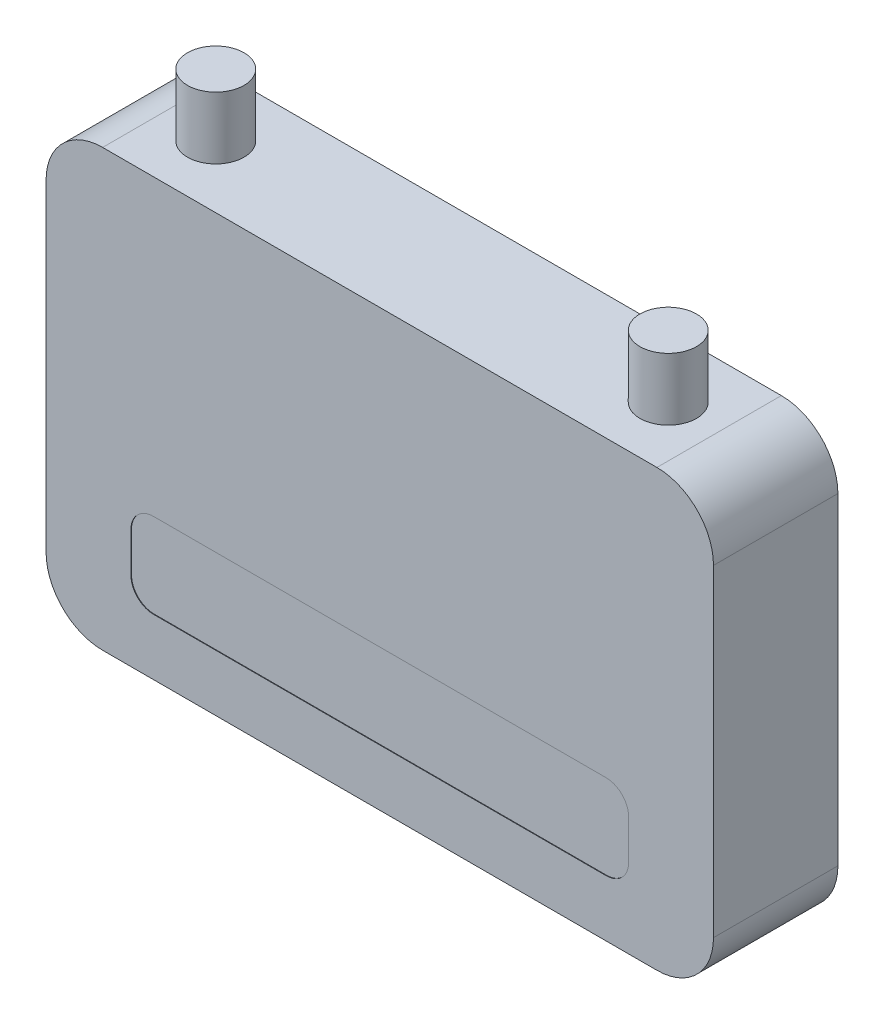
from build123d import *

# Parameters (mm, degrees)
BOSS_EXTRUDE1_DEPTH = 11
SKETCH2_R           = 5
BOSS_EXTRUDE2_DEPTH = 11
SKETCH3_R           = 3.25
BOSS_EXTRUDE3_DEPTH = 1
FILLET1_R           = 2
CUT_EXTRUDE1_DEPTH  = 0.1


with BuildPart() as part:
    # Sketch1 → Boss-Extrude1 (new, symmetric)
    with BuildSketch(Plane.XY):
        with BuildLine():
            Line((-49, -38.5), (49, -38.5))
            ThreePointArc((49, -38.5), (56.071067812, -35.571067812), (59, -28.5))
            Line((59, -28.5), (59, 28.5))
            ThreePointArc((59, 28.5), (56.071067812, 35.571067812), (49, 38.5))
            Line((49, 38.5), (-49, 38.5))
            ThreePointArc((-49, 38.5), (-56.071067812, 35.571067812), (-59, 28.5))
            Line((-59, 28.5), (-59, -28.5))
            ThreePointArc((-59, -28.5), (-56.071067812, -35.571067812), (-49, -38.5))
        make_face()
    extrude(amount=BOSS_EXTRUDE1_DEPTH, both=True)

    # Sketch2 → Boss-Extrude2 (add, symmetric)
    with BuildSketch(Plane(origin=(0, 38.5, 0), x_dir=(1, 0, 0), z_dir=(0, 1, 0))):
        with Locations(Location((-40, 0, 0), (0, 0, 90))):
            Circle(SKETCH2_R)
        with Locations(Location((40, 0, 0), (0, 0, 90))):
            Circle(SKETCH2_R)
    extrude(amount=BOSS_EXTRUDE2_DEPTH, both=True)

    # Sketch3 → Boss-Extrude3 (add, symmetric)
    with BuildSketch(Plane(origin=(0, 0, -11), x_dir=(-1, 0, 0), z_dir=(0, 0, -1))):
        with Locations((-48, 31)):
            Circle(SKETCH3_R)
        with Locations((-48, -31)):
            Circle(SKETCH3_R)
        with Locations((48, -31)):
            Circle(SKETCH3_R)
        with Locations((48, 31)):
            Circle(SKETCH3_R)
    extrude(amount=BOSS_EXTRUDE3_DEPTH, both=True)

    # Fillet1
    # the kernel refuses this fillet: 2 mm, written as the material it takes off along each edge
    with BuildSketch(Plane(origin=(48, 31, -12), x_dir=(-1, 0, 0), z_dir=(0, -1, 0))) as fillet1_piece_1:
        with BuildLine():
            CenterArc((1.517949192, -2), FILLET1_R, 30, 60)
            Line((1.517949192, 0), (1.517949192, 0.04))
            Line((1.517949192, 0.04), (3.25, 0.04))
            Line((3.25, 0.04), (3.29, 0))
            ThreePointArc((3.29, 0), (3.29, -0.5), (3.284641016, -0.98))
            Line((3.284641016, -0.98), (3.25, -1))
        make_face()
    revolve(axis=Axis((48, 31, -12), (0, 0, -1)), mode=Mode.SUBTRACT)
    with BuildSketch(Plane(origin=(48, -31, -12), x_dir=(-1, 0, 0), z_dir=(0, -1, 0))) as fillet1_piece_2:
        with BuildLine():
            CenterArc((1.517949192, -2), FILLET1_R, 30, 60)
            Line((1.517949192, 0), (1.517949192, 0.04))
            Line((1.517949192, 0.04), (3.25, 0.04))
            Line((3.25, 0.04), (3.29, 0))
            ThreePointArc((3.29, 0), (3.29, -0.5), (3.284641016, -0.98))
            Line((3.284641016, -0.98), (3.25, -1))
        make_face()
    revolve(axis=Axis((48, -31, -12), (0, 0, -1)), mode=Mode.SUBTRACT)
    with BuildSketch(Plane(origin=(-48, -31, -12), x_dir=(-1, 0, 0), z_dir=(0, -1, 0))) as fillet1_piece_3:
        with BuildLine():
            CenterArc((1.517949192, -2), FILLET1_R, 30, 60)
            Line((1.517949192, 0), (1.517949192, 0.04))
            Line((1.517949192, 0.04), (3.25, 0.04))
            Line((3.25, 0.04), (3.29, 0))
            ThreePointArc((3.29, 0), (3.29, -0.5), (3.284641016, -0.98))
            Line((3.284641016, -0.98), (3.25, -1))
        make_face()
    revolve(axis=Axis((-48, -31, -12), (0, 0, -1)), mode=Mode.SUBTRACT)
    with BuildSketch(Plane(origin=(-48, 31, -12), x_dir=(-1, 0, 0), z_dir=(0, -1, 0))) as fillet1_piece_4:
        with BuildLine():
            CenterArc((1.517949192, -2), FILLET1_R, 30, 60)
            Line((1.517949192, 0), (1.517949192, 0.04))
            Line((1.517949192, 0.04), (3.25, 0.04))
            Line((3.25, 0.04), (3.29, 0))
            ThreePointArc((3.29, 0), (3.29, -0.5), (3.284641016, -0.98))
            Line((3.284641016, -0.98), (3.25, -1))
        make_face()
    revolve(axis=Axis((-48, 31, -12), (0, 0, -1)), mode=Mode.SUBTRACT)

    # Sketch4 → Cut-Extrude1 (cut)
    with BuildSketch(Plane.XY.offset(11)):
        with BuildLine():
            Line((-40, -28.5), (40, -28.5))
            ThreePointArc((40, -28.5), (42.828427125, -27.328427125), (44, -24.5))
            Line((44, -24.5), (44, -17.5))
            ThreePointArc((44, -17.5), (42.828427125, -14.671572875), (40, -13.5))
            Line((40, -13.5), (-40, -13.5))
            ThreePointArc((-40, -13.5), (-42.828427125, -14.671572875), (-44, -17.5))
            Line((-44, -17.5), (-44, -24.5))
            ThreePointArc((-44, -24.5), (-42.828427125, -27.328427125), (-40, -28.5))
        make_face()
    extrude(amount=-CUT_EXTRUDE1_DEPTH, mode=Mode.SUBTRACT)


solid = part.part
